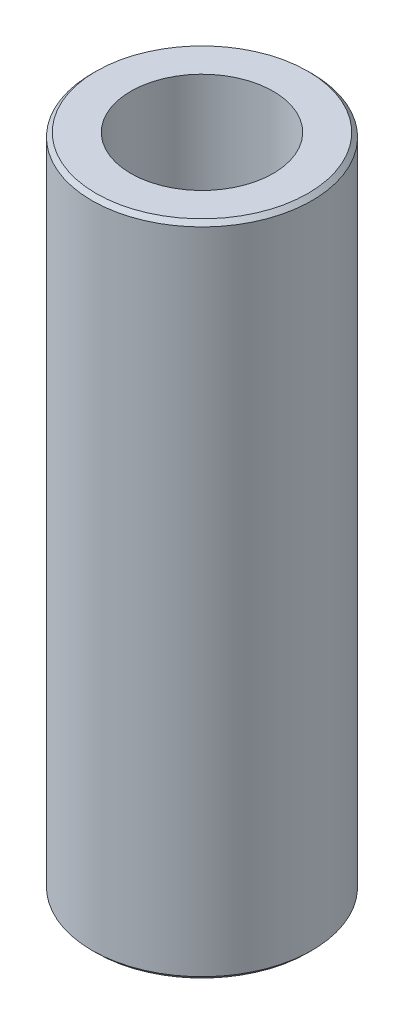
from build123d import *

# Parameters (mm, degrees)
SKETCH1_R           = 17.5
BOSS_EXTRUDE1_DEPTH = 104.592380714
SKETCH2_R           = 11.330884893
CUT_EXTRUDE1_DEPTH  = 108.480538254
CHAMFER1_SIZE       = 0.656659755


with BuildPart() as part:
    # Sketch1 → Boss-Extrude1 (new body)
    with BuildSketch(Plane(origin=(0, 0, 0), x_dir=(1, 0, 0), z_dir=(0, 1, 0))):
        Circle(SKETCH1_R)
    extrude(amount=BOSS_EXTRUDE1_DEPTH)

    # Sketch2 → Cut-Extrude1 (cut, through all)
    with BuildSketch(Plane(origin=(0, 0, 0), x_dir=(1, 0, 0), z_dir=(0, 1, 0))):
        Circle(SKETCH2_R)
    extrude(amount=CUT_EXTRUDE1_DEPTH, mode=Mode.SUBTRACT)

    # Chamfer1
    chamfer1_edges = [part.edges().sort_by_distance(p)[0] for p in [
        (-17.5, 104.592380714, 0),
        (-17.5, 0, 0),
    ]]
    chamfer(chamfer1_edges, length=CHAMFER1_SIZE)


solid = part.part
